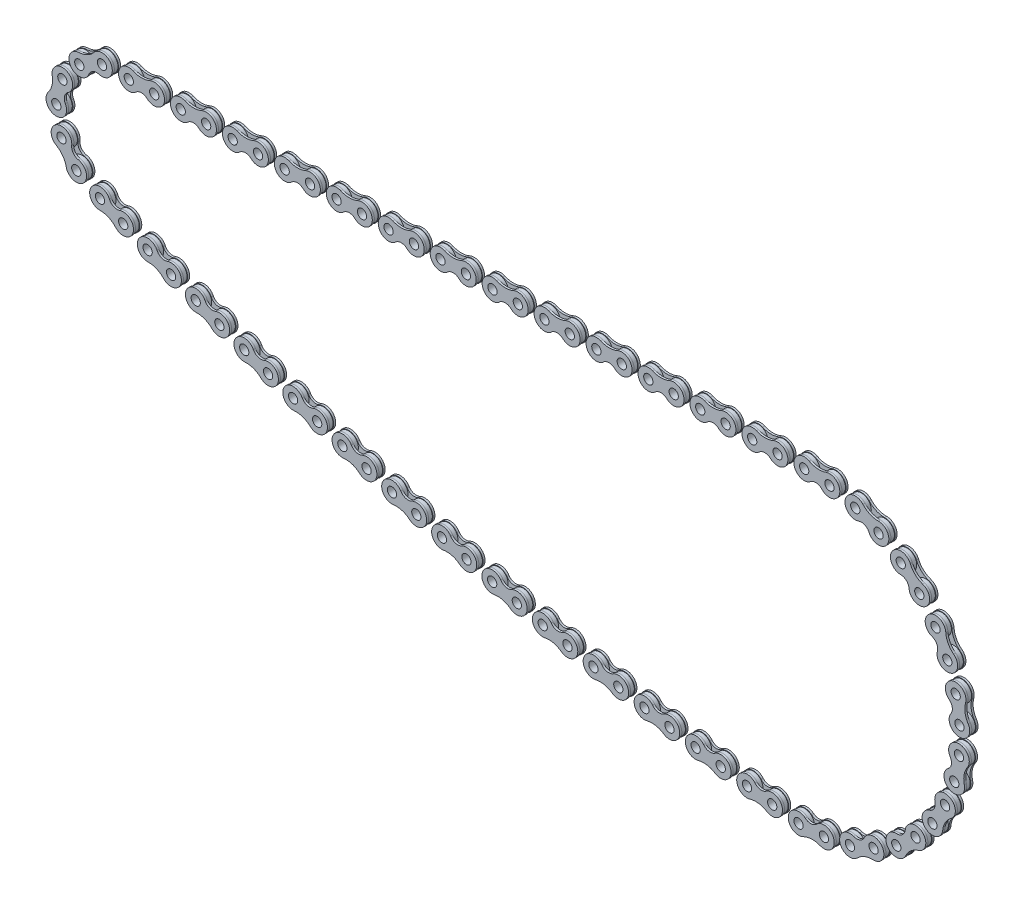
from build123d import *

# Parameters (mm, degrees)
SKETCH1_R             = 4.75
SKETCH1_R_2           = 2.25
BOSS_EXTRUDE1_DEPTH   = 1
BOSS_EXTRUDE1_2_DEPTH = 1
SKETCH2_R             = 2.25
BOSS_EXTRUDE2_DEPTH   = 1
CRVPATTERN1_5_ANGLE   = 4.4891132
CRVPATTERN1_6_ANGLE   = 23.7215852
CRVPATTERN1_7_ANGLE   = 42.9540573
CRVPATTERN1_8_ANGLE   = 62.1865294
CRVPATTERN1_9_ANGLE   = 81.4190015
CRVPATTERN1_10_ANGLE  = 100.6514735
CRVPATTERN1_11_ANGLE  = 119.8839456
CRVPATTERN1_12_ANGLE  = 139.1164177
CRVPATTERN1_13_ANGLE  = 158.3488898
CRVPATTERN1_14_ANGLE  = 177.5813619
CRVPATTERN1_15_ANGLE  = 172.4375527
CRVPATTERN1_16_ANGLE  = 171.1891449
CRVPATTERN1_17_ANGLE  = 169.940737
CRVPATTERN1_18_ANGLE  = 168.6923292
CRVPATTERN1_19_ANGLE  = 167.4439213
CRVPATTERN1_20_ANGLE  = 166.1955135
CRVPATTERN1_21_ANGLE  = 164.9471056
CRVPATTERN1_22_ANGLE  = 163.6986977
CRVPATTERN1_23_ANGLE  = 162.4502899
CRVPATTERN1_24_ANGLE  = 161.201882
CRVPATTERN1_25_ANGLE  = 159.9534742
CRVPATTERN1_26_ANGLE  = 158.7050663
CRVPATTERN1_27_ANGLE  = 157.4566585
CRVPATTERN1_28_ANGLE  = 156.2082506
CRVPATTERN1_29_ANGLE  = 125.7508825
CRVPATTERN1_30_ANGLE  = 76.1826555
CRVPATTERN1_31_ANGLE  = 26.6144285


with BuildPart() as part:
    # Sketch1 → Boss-Extrude1 (new, symmetric)
    with BuildSketch(Plane.XY):
        with Locations((-6.15, 0)):
            Circle(SKETCH1_R)
        with Locations((-6.15, 0)):
            Circle(SKETCH1_R_2, mode=Mode.SUBTRACT)
    extrude(amount=BOSS_EXTRUDE1_DEPTH, both=True)



with BuildPart() as body_2:
    # Sketch1 → Boss-Extrude1 2 (new, symmetric)
    with BuildSketch(Plane.XY):
        with Locations(Location((6.15, 0, 0), (0, 0, 180))):
            Circle(SKETCH1_R)
        with Locations((6.15, 0)):
            Circle(SKETCH1_R_2, mode=Mode.SUBTRACT)
    extrude(amount=BOSS_EXTRUDE1_2_DEPTH, both=True)


with BuildPart() as part_1:
    add(part.part)

    add(body_2.part)  # Boss-Extrude2 merges body 2
    # Sketch2 → Boss-Extrude2 (add)
    with BuildSketch(Plane.XY.offset(1)):
        with BuildLine():
            ThreePointArc((-4.102360887, 4.561488141), (-11.083814605, -0.81084736), (-2.750177945, -3.666225578))
            ThreePointArc((-2.750177945, -3.666225578), (0, -2.587311171), (2.750177945, -3.666225578))
            ThreePointArc((2.750177945, -3.666225578), (11.083814605, -0.81084736), (4.102360887, 4.561488141))
            ThreePointArc((4.102360887, 4.561488141), (0, 3.682947638), (-4.102360887, 4.561488141))
        make_face()
        with Locations((6.15, 0)):
            Circle(SKETCH2_R, mode=Mode.SUBTRACT)
        with Locations((-6.15, 0)):
            Circle(SKETCH2_R, mode=Mode.SUBTRACT)
    extrude(amount=BOSS_EXTRUDE2_DEPTH)

    # Mirror1: part across plane


with BuildPart() as part_2:
    add(part_1.part)
    add(part_1.part.mirror(Plane.XY))


with BuildPart() as body_2_2:
    # CrvPattern1: read off the stored shape, not the designer's step
    # CrvPattern1: copy of part
    add(part_2.part.moved(Location((25.1752471, 0, 0))))


with BuildPart() as body_3:
    # CrvPattern1 2: copy of part
    add(part_2.part.moved(Location((50.3504942, 0, 0))))


with BuildPart() as body_4:
    # CrvPattern1 3: copy of part
    add(part_2.part.moved(Location((75.5257412, 0, 0))))


with BuildPart() as body_5:
    # CrvPattern1 4: copy of part
    add(part_2.part.moved(Location((100.7009883, 0, 0))))


with BuildPart() as body_6:
    # CrvPattern1 5: copy of part
    add(part_2.part.moved(Location((125.4938893, 9.622122, 0))).rotate(Axis((0, 0, 0), (0, 0, -1)), CRVPATTERN1_5_ANGLE))


with BuildPart() as body_7:
    # CrvPattern1 6: copy of part
    add(part_2.part.moved(Location((139.9911247, 54.602938, 0))).rotate(Axis((0, 0, 0), (0, 0, -1)), CRVPATTERN1_6_ANGLE))


with BuildPart() as body_8:
    # CrvPattern1 7: copy of part
    add(part_2.part.moved(Location((138.8625047, 101.8487829, 0))).rotate(Axis((0, 0, 0), (0, 0, -1)), CRVPATTERN1_7_ANGLE))


with BuildPart() as body_9:
    # CrvPattern1 8: copy of part
    add(part_2.part.moved(Location((122.234006, 146.0860599, 0))).rotate(Axis((0, 0, 0), (0, 0, -1)), CRVPATTERN1_8_ANGLE))


with BuildPart() as body_10:
    # CrvPattern1 9: copy of part
    add(part_2.part.moved(Location((91.9617074, 182.3769896, 0))).rotate(Axis((0, 0, 0), (0, 0, -1)), CRVPATTERN1_9_ANGLE))


with BuildPart() as body_11:
    # CrvPattern1 10: copy of part
    add(part_2.part.moved(Location((51.4246126, 206.6707664, 0))).rotate(Axis((0, 0, 0), (0, 0, -1)), CRVPATTERN1_10_ANGLE))


with BuildPart() as body_12:
    # CrvPattern1 11: copy of part
    add(part_2.part.moved(Location((5.1474856, 216.2557109, 0))).rotate(Axis((0, 0, 0), (0, 0, -1)), CRVPATTERN1_11_ANGLE))


with BuildPart() as body_13:
    # CrvPattern1 12: copy of part
    add(part_2.part.moved(Location((-41.7042054, 210.0619486, 0))).rotate(Axis((0, 0, 0), (0, 0, -1)), CRVPATTERN1_12_ANGLE))


with BuildPart() as body_14:
    # CrvPattern1 13: copy of part
    add(part_2.part.moved(Location((-83.9008593, 188.7808291, 0))).rotate(Axis((0, 0, 0), (0, 0, -1)), CRVPATTERN1_13_ANGLE))


with BuildPart() as body_15:
    # CrvPattern1 14: copy of part
    add(part_2.part.moved(Location((-116.7324716, 154.7877581, 0))).rotate(Axis((0, 0, 0), (0, 0, -1)), CRVPATTERN1_14_ANGLE))


with BuildPart() as body_16:
    # CrvPattern1 15: copy of part
    add(part_2.part.moved(Location((-116.7031681, 133.4140246, 0))).rotate(Axis((0, 0, 0), (0, 0, 1)), CRVPATTERN1_15_ANGLE))


with BuildPart() as body_17:
    # CrvPattern1 16: copy of part
    add(part_2.part.moved(Location((-94.4111999, 131.1139663, 0))).rotate(Axis((0, 0, 0), (0, 0, 1)), CRVPATTERN1_16_ANGLE))


with BuildPart() as body_18:
    # CrvPattern1 17: copy of part
    add(part_2.part.moved(Location((-72.0744115, 129.3001314, 0))).rotate(Axis((0, 0, 0), (0, 0, 1)), CRVPATTERN1_17_ANGLE))


with BuildPart() as body_19:
    # CrvPattern1 18: copy of part
    add(part_2.part.moved(Location((-49.703407, 127.973381, 0))).rotate(Axis((0, 0, 0), (0, 0, 1)), CRVPATTERN1_18_ANGLE))


with BuildPart() as body_20:
    # CrvPattern1 19: copy of part
    add(part_2.part.moved(Location((-27.3088065, 127.1343449, 0))).rotate(Axis((0, 0, 0), (0, 0, 1)), CRVPATTERN1_19_ANGLE))


with BuildPart() as body_21:
    # CrvPattern1 20: copy of part
    add(part_2.part.moved(Location((-4.9012416, 126.7834214, 0))).rotate(Axis((0, 0, 0), (0, 0, 1)), CRVPATTERN1_20_ANGLE))


with BuildPart() as body_22:
    # CrvPattern1 21: copy of part
    add(part_2.part.moved(Location((17.5086501, 126.9207771, 0))).rotate(Axis((0, 0, 0), (0, 0, 1)), CRVPATTERN1_21_ANGLE))


with BuildPart() as body_23:
    # CrvPattern1 22: copy of part
    add(part_2.part.moved(Location((39.9102298, 127.5463469, 0))).rotate(Axis((0, 0, 0), (0, 0, 1)), CRVPATTERN1_22_ANGLE))


with BuildPart() as body_24:
    # CrvPattern1 23: copy of part
    add(part_2.part.moved(Location((62.2928628, 128.6598338, 0))).rotate(Axis((0, 0, 0), (0, 0, 1)), CRVPATTERN1_23_ANGLE))


with BuildPart() as body_25:
    # CrvPattern1 24: copy of part
    add(part_2.part.moved(Location((84.6459232, 130.260709, 0))).rotate(Axis((0, 0, 0), (0, 0, 1)), CRVPATTERN1_24_ANGLE))


with BuildPart() as body_26:
    # CrvPattern1 25: copy of part
    add(part_2.part.moved(Location((106.9587993, 132.3482127, 0))).rotate(Axis((0, 0, 0), (0, 0, 1)), CRVPATTERN1_25_ANGLE))


with BuildPart() as body_27:
    # CrvPattern1 26: copy of part
    add(part_2.part.moved(Location((129.2208984, 134.9213539, 0))).rotate(Axis((0, 0, 0), (0, 0, 1)), CRVPATTERN1_26_ANGLE))


with BuildPart() as body_28:
    # CrvPattern1 27: copy of part
    add(part_2.part.moved(Location((151.421652, 137.9789109, 0))).rotate(Axis((0, 0, 0), (0, 0, 1)), CRVPATTERN1_27_ANGLE))


with BuildPart() as body_29:
    # CrvPattern1 28: copy of part
    add(part_2.part.moved(Location((173.5505204, 141.5194323, 0))).rotate(Axis((0, 0, 0), (0, 0, 1)), CRVPATTERN1_28_ANGLE))


with BuildPart() as body_30:
    # CrvPattern1 29: copy of part
    add(part_2.part.moved(Location((100.9514086, 218.8480324, 0))).rotate(Axis((0, 0, 0), (0, 0, 1)), CRVPATTERN1_29_ANGLE))


with BuildPart() as body_31:
    # CrvPattern1 30: copy of part
    add(part_2.part.moved(Location((-79.0407086, 228.9648258, 0))).rotate(Axis((0, 0, 0), (0, 0, 1)), CRVPATTERN1_30_ANGLE))


with BuildPart() as body_32:
    # CrvPattern1 31: copy of part
    add(part_2.part.moved(Location((-203.4738641, 98.5198122, 0))).rotate(Axis((0, 0, 0), (0, 0, 1)), CRVPATTERN1_31_ANGLE))


with BuildPart() as body_33:
    # CrvPattern1 32: copy of part
    add(part_2.part.moved(Location((-201.4019766, 0, 0))))


with BuildPart() as body_34:
    # CrvPattern1 33: copy of part
    add(part_2.part.moved(Location((-176.2267295, 0, 0))))


with BuildPart() as body_35:
    # CrvPattern1 34: copy of part
    add(part_2.part.moved(Location((-151.0514825, 0, 0))))


with BuildPart() as body_36:
    # CrvPattern1 35: copy of part
    add(part_2.part.moved(Location((-125.8762354, 0, 0))))


with BuildPart() as body_37:
    # CrvPattern1 36: copy of part
    add(part_2.part.moved(Location((-100.7009883, 0, 0))))


with BuildPart() as body_38:
    # CrvPattern1 37: copy of part
    add(part_2.part.moved(Location((-75.5257412, 0, 0))))


with BuildPart() as body_39:
    # CrvPattern1 38: copy of part
    add(part_2.part.moved(Location((-50.3504942, 0, 0))))


with BuildPart() as body_40:
    # CrvPattern1 39: copy of part
    add(part_2.part.moved(Location((-25.1752471, 0, 0))))


solid = Compound([part_2.part, body_2_2.part, body_3.part, body_4.part, body_5.part, body_6.part, body_7.part, body_8.part, body_9.part, body_10.part, body_11.part, body_12.part, body_13.part, body_14.part, body_15.part, body_16.part, body_17.part, body_18.part, body_19.part, body_20.part, body_21.part, body_22.part, body_23.part, body_24.part, body_25.part, body_26.part, body_27.part, body_28.part, body_29.part, body_30.part, body_31.part, body_32.part, body_33.part, body_34.part, body_35.part, body_36.part, body_37.part, body_38.part, body_39.part, body_40.part])
